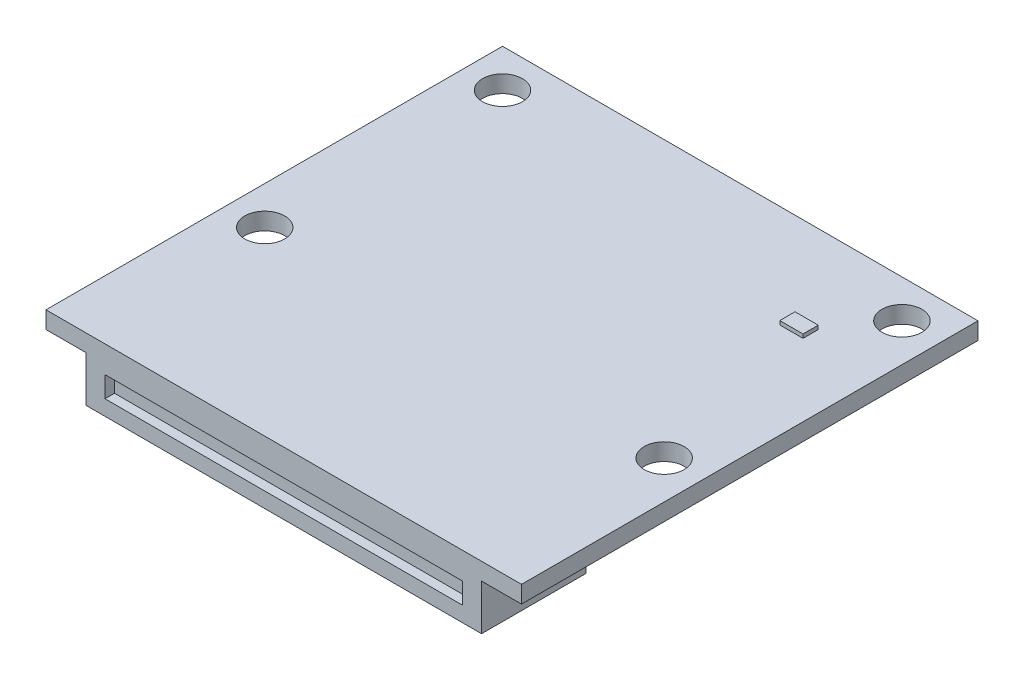
from build123d import *

# Parameters (mm, degrees)
SKIZZE1_W               = 25
SKIZZE1_H               = 24
PCB_DEPTH               = 0.9
SKIZZE2_R               = 1.05
MOUNTING_HOLES_DEPTH    = 20.165333287
SKIZZE3_W               = 20.8
SKIZZE3_H               = 5.5
CONNECTOR_CLOSED_DEPTH  = 2.4
ESQUISSE1_W             = 1.22
ESQUISSE1_H             = 0.8
STATUS_LED_DEPTH        = 0.2
ESQUISSE3_W             = 18.8
ESQUISSE3_H             = 1.1
ENL_V_MAT_EXTRU_1_DEPTH = 0.5


with BuildPart() as part:
    # Skizze1 → PCB (new body)
    with BuildSketch(Plane(origin=(0, 0, 0), x_dir=(1, 0, 0), z_dir=(0, 1, 0))):
        with Locations((0, 2.5)):
            Rectangle(SKIZZE1_W, SKIZZE1_H)
    extrude(amount=-PCB_DEPTH)

    # Skizze2 → Mounting_Holes (cut, through all)
    with BuildSketch(Plane(origin=(0, 0, 0), x_dir=(1, 0, 0), z_dir=(0, 1, 0))):
        with Locations((10.5, 12.5)):
            Circle(SKIZZE2_R)
        with Locations((10.5, 0)):
            Circle(SKIZZE2_R)
        with Locations((-10.5, 0)):
            Circle(SKIZZE2_R)
        with Locations((-10.5, 12.5)):
            Circle(SKIZZE2_R)
    extrude(amount=-MOUNTING_HOLES_DEPTH, mode=Mode.SUBTRACT)

    # Skizze3 → Connector_closed (add)
    with BuildSketch(Plane.XZ.offset(0.9)):
        with Locations((0, 6.75)):
            Rectangle(SKIZZE3_W, SKIZZE3_H)
    extrude(amount=CONNECTOR_CLOSED_DEPTH)

    # Esquisse1 → Status LED (add)
    with BuildSketch(Plane(origin=(0, 0, 0), x_dir=(1, 0, 0), z_dir=(0, 1, 0))):
        with Locations((8.09, 9.5)):
            Rectangle(ESQUISSE1_W, ESQUISSE1_H)
    extrude(amount=STATUS_LED_DEPTH)

    # Esquisse3 → Enlèv. mat.-Extru.1 (cut)
    with BuildSketch(Plane.XY.offset(9.5)):
        with Locations((0, -1.95)):
            Rectangle(ESQUISSE3_W, ESQUISSE3_H)
    extrude(amount=-ENL_V_MAT_EXTRU_1_DEPTH, mode=Mode.SUBTRACT)


solid = part.part
